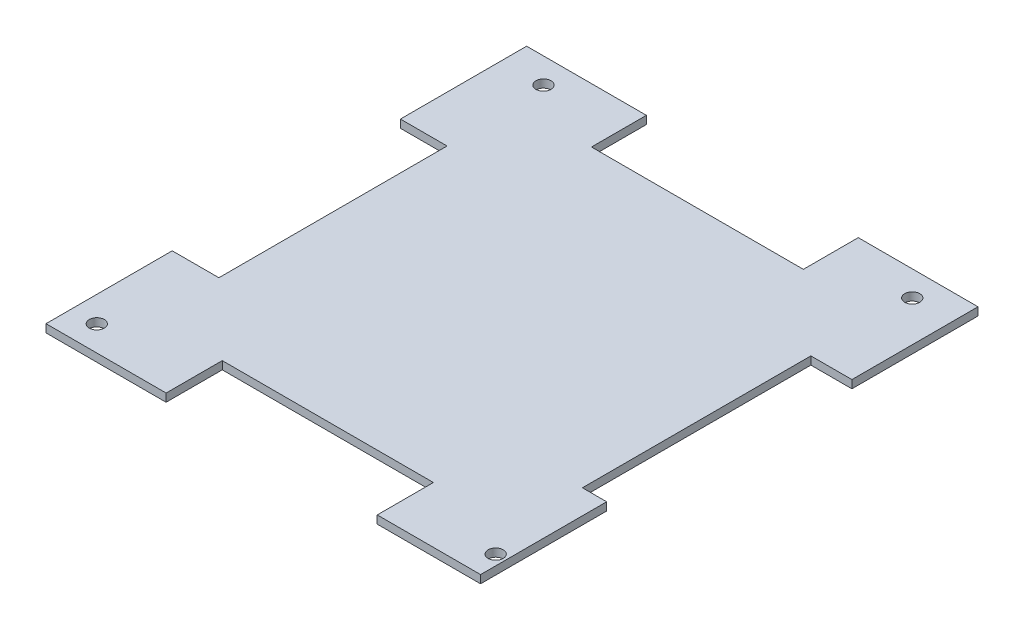
from build123d import *

# Parameters (mm, degrees)
SKETCH2_W           = 84.57
SKETCH2_H           = 90.8
BOSS_EXTRUDE1_DEPTH = 1.6
SKETCH3_R           = 1.5
CUT_EXTRUDE1_DEPTH  = 125.093855206
SKETCH4_W           = 90.8
SKETCH4_H           = 1.6
BOSS_EXTRUDE2_DEPTH = 2.88
SKETCH5_W           = 90.8
SKETCH5_H           = 1.6
BOSS_EXTRUDE3_DEPTH = 2.59
SKETCH6_W           = 90.04
SKETCH6_H           = 1.6
BOSS_EXTRUDE4_DEPTH = 2.54
SKETCH7_W           = 90.04
SKETCH7_H           = 1.6
BOSS_EXTRUDE5_DEPTH = 2.54
SKETCH8_W           = 16.372642976
SKETCH8_H           = 45.571517242
SKETCH8_W_2         = 42.266473234
SKETCH8_H_2         = 21.901065616
SKETCH8_W_3         = 18.617013656
SKETCH8_H_3         = 45.520108402
SKETCH8_W_4         = 42.118702304
SKETCH8_H_4         = 22.400138828
CUT_EXTRUDE2_DEPTH  = 128.915667922
SKETCH9_W           = 25.154241379
SKETCH9_H           = 1.6
CUT_EXTRUDE3_DEPTH  = 3.35


with BuildPart() as part:
    # Sketch2 → Boss-Extrude1 (new body)
    with BuildSketch(Plane(origin=(0, 0, 0), x_dir=(1, 0, 0), z_dir=(0, 1, 0))):
        with Locations((42.285, 45.4)):
            Rectangle(SKETCH2_W, SKETCH2_H)
    extrude(amount=BOSS_EXTRUDE1_DEPTH)

    # Sketch3 → Cut-Extrude1 (cut, through all)
    with BuildSketch(Plane(origin=(0, 1.6, 0), x_dir=(1, 0, 0), z_dir=(0, 1, 0))):
        with Locations((2.5, 2.5)):
            Circle(SKETCH3_R)
        with Locations((82.07, 2.5)):
            Circle(SKETCH3_R)
        with Locations((5.8, 88.3)):
            Circle(SKETCH3_R)
        with Locations((79.37, 88.3)):
            Circle(SKETCH3_R)
    extrude(amount=-CUT_EXTRUDE1_DEPTH, mode=Mode.SUBTRACT)

    # Sketch4 → Boss-Extrude2 (add)
    with BuildSketch(Plane(origin=(84.57, 0, 0), x_dir=(0, 0, -1), z_dir=(1, 0, 0))):
        with Locations((45.4, 0.8)):
            Rectangle(SKETCH4_W, SKETCH4_H)
    extrude(amount=BOSS_EXTRUDE2_DEPTH)

    # Sketch5 → Boss-Extrude3 (add)
    with BuildSketch(Plane.ZY):
        with Locations((-45.4, 0.8)):
            Rectangle(SKETCH5_W, SKETCH5_H)
    extrude(amount=BOSS_EXTRUDE3_DEPTH)

    # Sketch6 → Boss-Extrude4 (add)
    with BuildSketch(Plane(origin=(0, 0, -90.8), x_dir=(-1, 0, 0), z_dir=(0, 0, -1))):
        with Locations((-42.43, 0.8)):
            Rectangle(SKETCH6_W, SKETCH6_H)
    extrude(amount=BOSS_EXTRUDE4_DEPTH)

    # Sketch7 → Boss-Extrude5 (add)
    with BuildSketch(Plane.XY):
        with Locations((42.43, 0.8)):
            Rectangle(SKETCH7_W, SKETCH7_H)
    extrude(amount=BOSS_EXTRUDE5_DEPTH)

    # Sketch8 → Cut-Extrude2 (cut, through all)
    with BuildSketch(Plane(origin=(0, 1.6, 0), x_dir=(1, 0, 0), z_dir=(0, 1, 0))):
        with Locations((87.45, 45.4)):
            Rectangle(SKETCH8_W, SKETCH8_H)
        with Locations((42.43, 93.34)):
            Rectangle(SKETCH8_W_2, SKETCH8_H_2)
        with Locations((-2.59, 45.4)):
            Rectangle(SKETCH8_W_3, SKETCH8_H_3)
        with Locations((42.43, -2.54)):
            Rectangle(SKETCH8_W_4, SKETCH8_H_4)
    extrude(amount=-CUT_EXTRUDE2_DEPTH, mode=Mode.SUBTRACT)

    # Sketch9 → Cut-Extrude3 (cut)
    with BuildSketch(Plane(origin=(87.45, 0, 0), x_dir=(0, 0, -1), z_dir=(1, 0, 0))):
        with Locations((10.03712069, 0.8)):
            Rectangle(SKETCH9_W, SKETCH9_H)
    extrude(amount=-CUT_EXTRUDE3_DEPTH, mode=Mode.SUBTRACT)


solid = part.part
